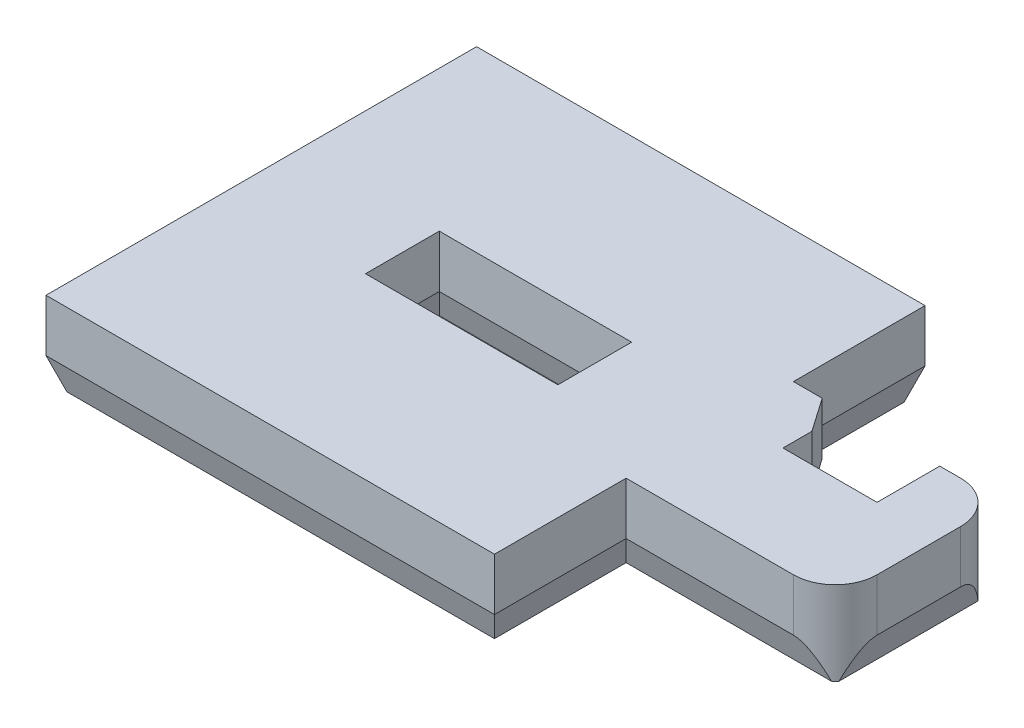
from build123d import *
from OCP.BRepFilletAPI import BRepFilletAPI_MakeChamfer

# Parameters (mm, degrees)
SKETCH1_W           = 21.447515714
SKETCH1_H           = 20.590988136
SKETCH1_W_2         = 9.2
SKETCH1_H_2         = 3.53
BOSS_EXTRUDE1_DEPTH = 4
SKETCH2_W           = 10
SKETCH2_H           = 8
BOSS_EXTRUDE3_DEPTH = 4
CUT_EXTRUDE1_DEPTH  = 24.022536743
CHAMFER1_SIZE       = 1.5
CHAMFER1_SIZE2      = 0.5
FILLET1_R           = 2


with BuildPart() as part:
    # Sketch1 → Boss-Extrude1 (new body)
    with BuildSketch(Plane(origin=(0, 0, 0), x_dir=(1, 0, 0), z_dir=(0, 1, 0))):
        with Locations((-0.523757857, 0)):
            Rectangle(SKETCH1_W, SKETCH1_H)
        with Locations((0.1, 0)):
            Rectangle(SKETCH1_W_2, SKETCH1_H_2, mode=Mode.SUBTRACT)
    extrude(amount=BOSS_EXTRUDE1_DEPTH)

    # Sketch2 → Boss-Extrude3 (add)
    with BuildSketch(Plane(origin=(0, 0, 0), x_dir=(1, 0, 0), z_dir=(0, 1, 0))):
        with Locations((15.2, 0)):
            Rectangle(SKETCH2_W, SKETCH2_H)
    extrude(amount=BOSS_EXTRUDE3_DEPTH)

    # Sketch3 → Cut-Extrude1 (cut, through all)
    with BuildSketch(Plane(origin=(0, 0, 0), x_dir=(1, 0, 0), z_dir=(0, 1, 0))):
        Polygon((12.7, 1), (12.7, 2.38454447), (11.576199706, 4), (12.7, 4), (17.2, 4), (17.2, 1), align=None)
    extrude(amount=CUT_EXTRUDE1_DEPTH, mode=Mode.SUBTRACT)

    # Chamfer1: one chamfer whose edges measure the first distance from different faces: ONE call of the kernel's chamfer builder (chamfer() names one face for all edges)
    chamfer1_edges_1 = [part.edges().sort_by_distance(p)[0] for p in [
        (4.7, 0, 0),
    ]]
    chamfer1_side_1 = [part.faces().sort_by_distance(p)[0] for p in [
        (4.7, 2, 0),
    ]]
    chamfer1_edges_2 = [part.edges().sort_by_distance(p)[0] for p in [
        (0.1, 0, -1.765),
    ]]
    chamfer1_side_2 = [part.faces().sort_by_distance(p)[0] for p in [
        (0.1, 2, -1.765),
    ]]
    chamfer1_edges_3 = [part.edges().sort_by_distance(p)[0] for p in [
        (-4.5, 0, 0),
    ]]
    chamfer1_side_3 = [part.faces().sort_by_distance(p)[0] for p in [
        (-4.5, 2, 0),
    ]]
    chamfer1_edges_4 = [part.edges().sort_by_distance(p)[0] for p in [
        (0.1, 0, 1.765),
    ]]
    chamfer1_side_4 = [part.faces().sort_by_distance(p)[0] for p in [
        (0.1, 2, 1.765),
    ]]
    chamfer1_edges_5 = [part.edges().sort_by_distance(p)[0] for p in [
        (10.2, 0, -7.147747034),
    ]]
    chamfer1_side_5 = [part.faces().sort_by_distance(p)[0] for p in [
        (10.2, 2, -7.147747034),
    ]]
    chamfer1_edges_6 = [part.edges().sort_by_distance(p)[0] for p in [
        (15.2, 0, 4),
    ]]
    chamfer1_side_6 = [part.faces().sort_by_distance(p)[0] for p in [
        (15.2, 2, 4),
    ]]
    chamfer1_edges_7 = [part.edges().sort_by_distance(p)[0] for p in [
        (20.2, 0, 0),
    ]]
    chamfer1_side_7 = [part.faces().sort_by_distance(p)[0] for p in [
        (20.2, 2, 0),
    ]]
    chamfer1_edges_8 = [part.edges().sort_by_distance(p)[0] for p in [
        (18.7, 0, -4),
    ]]
    chamfer1_side_8 = [part.faces().sort_by_distance(p)[0] for p in [
        (18.7, 2, -4),
    ]]
    chamfer1_edges_9 = [part.edges().sort_by_distance(p)[0] for p in [
        (10.888099853, 0, -4),
    ]]
    chamfer1_side_9 = [part.faces().sort_by_distance(p)[0] for p in [
        (10.888099853, 2, -4),
    ]]
    chamfer1_edges_10 = [part.edges().sort_by_distance(p)[0] for p in [
        (12.138099853, 0, -3.192272235),
    ]]
    chamfer1_side_10 = [part.faces().sort_by_distance(p)[0] for p in [
        (12.138099853, 2, -3.192272235),
    ]]
    chamfer1_edges_11 = [part.edges().sort_by_distance(p)[0] for p in [
        (12.7, 0, -1.692272235),
    ]]
    chamfer1_side_11 = [part.faces().sort_by_distance(p)[0] for p in [
        (12.7, 2, -1.692272235),
    ]]
    chamfer1_edges_12 = [part.edges().sort_by_distance(p)[0] for p in [
        (14.95, 0, -1),
    ]]
    chamfer1_side_12 = [part.faces().sort_by_distance(p)[0] for p in [
        (14.95, 2, -1),
    ]]
    chamfer1_edges_13 = [part.edges().sort_by_distance(p)[0] for p in [
        (17.2, 0, -2.5),
    ]]
    chamfer1_side_13 = [part.faces().sort_by_distance(p)[0] for p in [
        (17.2, 2, -2.5),
    ]]
    chamfer1_edges_14 = [part.edges().sort_by_distance(p)[0] for p in [
        (-0.523757857, 0, -10.295494068),
    ]]
    chamfer1_side_14 = [part.faces().sort_by_distance(p)[0] for p in [
        (-0.523757857, 2, -10.295494068),
    ]]
    chamfer1_edges_15 = [part.edges().sort_by_distance(p)[0] for p in [
        (10.2, 0, 7.147747034),
    ]]
    chamfer1_side_15 = [part.faces().sort_by_distance(p)[0] for p in [
        (10.2, 2, 7.147747034),
    ]]
    chamfer1_edges_16 = [part.edges().sort_by_distance(p)[0] for p in [
        (-0.523757857, 0, 10.295494068),
    ]]
    chamfer1_side_16 = [part.faces().sort_by_distance(p)[0] for p in [
        (-0.523757857, 2, 10.295494068),
    ]]
    chamfer1_edges_17 = [part.edges().sort_by_distance(p)[0] for p in [
        (-11.247515714, 0, 0),
    ]]
    chamfer1_side_17 = [part.faces().sort_by_distance(p)[0] for p in [
        (-11.247515714, 2, 0),
    ]]
    chamfer1 = BRepFilletAPI_MakeChamfer(part.part.solid().wrapped)
    for e in chamfer1_edges_1:
        chamfer1.Add(CHAMFER1_SIZE, CHAMFER1_SIZE2, e.wrapped, chamfer1_side_1[0].wrapped)  # the first distance lies on this face
    for e in chamfer1_edges_2:
        chamfer1.Add(CHAMFER1_SIZE, CHAMFER1_SIZE2, e.wrapped, chamfer1_side_2[0].wrapped)  # the first distance lies on this face
    for e in chamfer1_edges_3:
        chamfer1.Add(CHAMFER1_SIZE, CHAMFER1_SIZE2, e.wrapped, chamfer1_side_3[0].wrapped)  # the first distance lies on this face
    for e in chamfer1_edges_4:
        chamfer1.Add(CHAMFER1_SIZE, CHAMFER1_SIZE2, e.wrapped, chamfer1_side_4[0].wrapped)  # the first distance lies on this face
    for e in chamfer1_edges_5:
        chamfer1.Add(CHAMFER1_SIZE, CHAMFER1_SIZE2, e.wrapped, chamfer1_side_5[0].wrapped)  # the first distance lies on this face
    for e in chamfer1_edges_6:
        chamfer1.Add(CHAMFER1_SIZE, CHAMFER1_SIZE2, e.wrapped, chamfer1_side_6[0].wrapped)  # the first distance lies on this face
    for e in chamfer1_edges_7:
        chamfer1.Add(CHAMFER1_SIZE, CHAMFER1_SIZE2, e.wrapped, chamfer1_side_7[0].wrapped)  # the first distance lies on this face
    for e in chamfer1_edges_8:
        chamfer1.Add(CHAMFER1_SIZE, CHAMFER1_SIZE2, e.wrapped, chamfer1_side_8[0].wrapped)  # the first distance lies on this face
    for e in chamfer1_edges_9:
        chamfer1.Add(CHAMFER1_SIZE, CHAMFER1_SIZE2, e.wrapped, chamfer1_side_9[0].wrapped)  # the first distance lies on this face
    for e in chamfer1_edges_10:
        chamfer1.Add(CHAMFER1_SIZE, CHAMFER1_SIZE2, e.wrapped, chamfer1_side_10[0].wrapped)  # the first distance lies on this face
    for e in chamfer1_edges_11:
        chamfer1.Add(CHAMFER1_SIZE, CHAMFER1_SIZE2, e.wrapped, chamfer1_side_11[0].wrapped)  # the first distance lies on this face
    for e in chamfer1_edges_12:
        chamfer1.Add(CHAMFER1_SIZE, CHAMFER1_SIZE2, e.wrapped, chamfer1_side_12[0].wrapped)  # the first distance lies on this face
    for e in chamfer1_edges_13:
        chamfer1.Add(CHAMFER1_SIZE, CHAMFER1_SIZE2, e.wrapped, chamfer1_side_13[0].wrapped)  # the first distance lies on this face
    for e in chamfer1_edges_14:
        chamfer1.Add(CHAMFER1_SIZE, CHAMFER1_SIZE2, e.wrapped, chamfer1_side_14[0].wrapped)  # the first distance lies on this face
    for e in chamfer1_edges_15:
        chamfer1.Add(CHAMFER1_SIZE, CHAMFER1_SIZE2, e.wrapped, chamfer1_side_15[0].wrapped)  # the first distance lies on this face
    for e in chamfer1_edges_16:
        chamfer1.Add(CHAMFER1_SIZE, CHAMFER1_SIZE2, e.wrapped, chamfer1_side_16[0].wrapped)  # the first distance lies on this face
    for e in chamfer1_edges_17:
        chamfer1.Add(CHAMFER1_SIZE, CHAMFER1_SIZE2, e.wrapped, chamfer1_side_17[0].wrapped)  # the first distance lies on this face
    add(Compound.cast(chamfer1.Shape()), mode=Mode.REPLACE)

    # Fillet1
    # the kernel refuses this fillet: 2 mm, written as the material it takes off along each edge
    with BuildSketch(Plane(origin=(20.2, -3.5, 4), x_dir=(-1, 0, 0), z_dir=(0, 1, 0)), Plane(origin=(20.2, -3.5, -4), x_dir=(0, 0, 1), z_dir=(0, 1, 0))) as fillet1_piece_1:
        with BuildLine():
            CenterArc((FILLET1_R, -FILLET1_R), FILLET1_R, 90, 90)
            Line((0, -FILLET1_R), (0, 0))
            Line((0, 0), (FILLET1_R, 0))
        make_face()
    extrude(amount=12.5, mode=Mode.SUBTRACT)


solid = part.part
